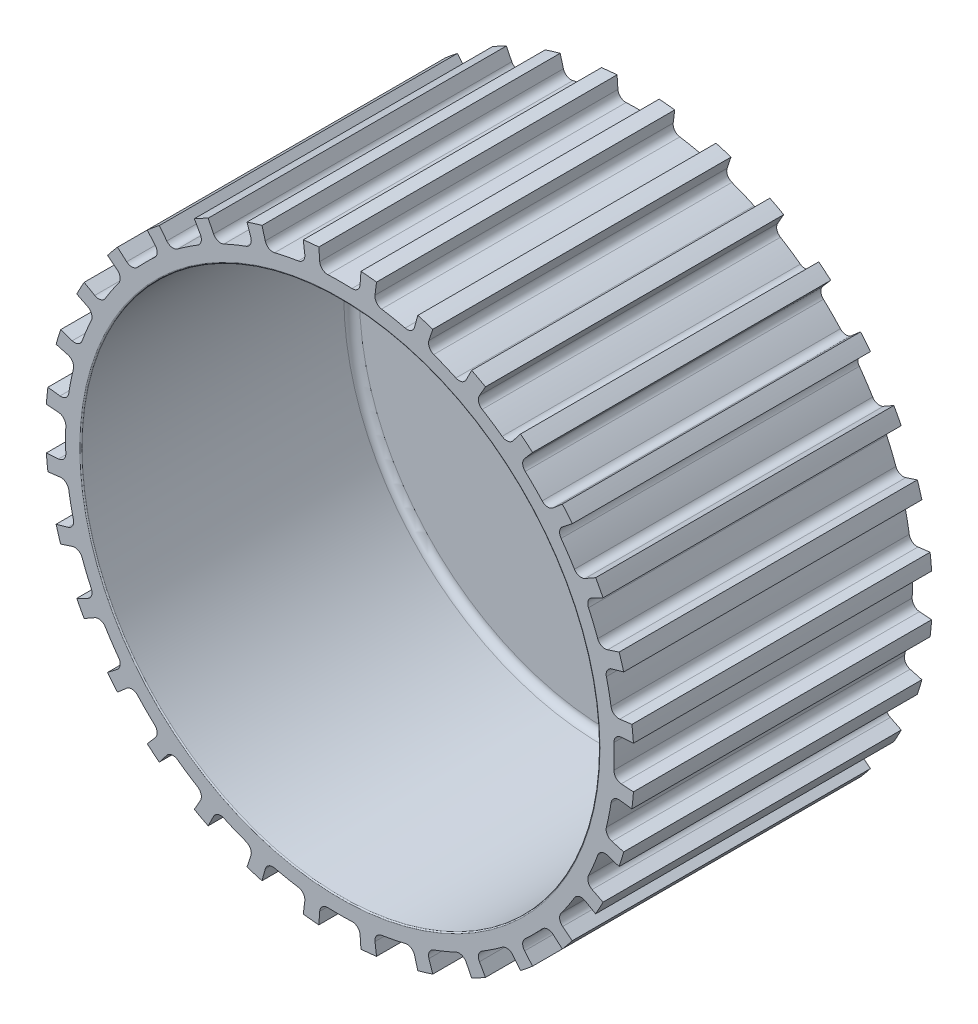
from build123d import *

# Parameters (mm, degrees)
SKETCH_1_R          = 75
EXTRUDE_1_DEPTH     = 7
SKETCH_2_R          = 75
SKETCH_2_R_2        = 66
EXTRUDE_2_DEPTH     = 69
SKETCH_4_R          = 14
EXTRUDE_3_DEPTH     = 7
SKETCH_5_R          = 5.05
SKETCH_5_R_2        = 1.2
CUT_EXTRUDE_2_DEPTH = 131.483715459
CUT_EXTRUDE_3_DEPTH = 131.483715459
FILLET_2_R          = 2
FILLET1_R           = 2
CHAMFER1_SIZE       = 0.3
FILLET2_R           = 0.3
FILLET_3_R          = 8
SKETCH_8_R          = 1.45
CUT_EXTRUDE_5_DEPTH = 123.623274056


with BuildPart() as part:
    # 草图1 → 凸台-拉伸1 (new body)
    with BuildSketch(Plane.XY):
        Circle(SKETCH_1_R)
    extrude(amount=EXTRUDE_1_DEPTH)

    # 草图2 → 凸台-拉伸2 (add)
    with BuildSketch(Plane.XY.offset(7)):
        Circle(SKETCH_2_R)
        Circle(SKETCH_2_R_2, mode=Mode.SUBTRACT)
    extrude(amount=EXTRUDE_2_DEPTH)

    # 草图4 → 凸台-拉伸3 (add)
    with BuildSketch(Plane.XY.offset(7)):
        Circle(SKETCH_4_R)
    extrude(amount=EXTRUDE_3_DEPTH)

    # 草图5 → 切除-拉伸2 (cut, through all)
    with BuildSketch(Plane(origin=(0, 0, 0), x_dir=(-1, 0, 0), z_dir=(0, 0, -1))):
        Circle(SKETCH_5_R)
        with Locations((0, 8)):
            Circle(SKETCH_5_R_2)
        with Locations((8, 0)):
            Circle(SKETCH_5_R_2)
        with Locations((0, -8)):
            Circle(SKETCH_5_R_2)
        with Locations((-8, 0)):
            Circle(SKETCH_5_R_2)
    extrude(amount=-CUT_EXTRUDE_2_DEPTH, mode=Mode.SUBTRACT)

    # 草图6 → 切除-拉伸3 (cut, through all)
    with BuildSketch(Plane.XY.offset(76)):
        with BuildLine():
            Line((5.694360027, 79.423791275), (5, 69.738996918))
            ThreePointArc((5, 69.738996918), (0, 69.918006916), (-5, 69.738996918))
            Line((-5, 69.738996918), (-5.694360027, 79.423791275))
            ThreePointArc((-5.694360027, 79.423791275), (0, 79.627660751), (5.694360027, 79.423791275))
        make_face()
        with BuildLine():
            Line((9.90986852, 79.008599928), (8.701476964, 69.374433257))
            ThreePointArc((8.701476964, 69.374433257), (13.640326484, 68.574552018), (18.509329767, 67.423530037))
            Line((18.509329767, 67.423530037), (21.079757511, 76.786770865))
            ThreePointArc((21.079757511, 76.786770865), (15.534585977, 78.097637577), (9.90986852, 79.008599928))
        make_face()
        with BuildLine():
            Line((25.133266377, 75.557152394), (22.068561048, 66.343849032))
            ThreePointArc((22.068561048, 66.343849032), (26.756462871, 64.595815544), (31.307356372, 62.517014709))
            Line((31.307356372, 62.517014709), (35.655071736, 71.198877913))
            ThreePointArc((35.655071736, 71.198877913), (30.472186527, 73.566365989), (25.133266377, 75.557152394))
        make_face()
        with BuildLine():
            Line((39.390806902, 69.202085866), (34.587562707, 60.763707895))
            ThreePointArc((34.587562707, 60.763707895), (38.844363395, 58.134698103), (42.902258829, 55.208005565))
            Line((42.902258829, 55.208005565), (48.86018155, 62.874852012))
            ThreePointArc((48.86018155, 62.874852012), (44.238758038, 66.207980213), (39.390806902, 69.202085866))
        make_face()
        with BuildLine():
            Line((52.134580809, 60.187621987), (45.777383728, 52.848451539))
            ThreePointArc((45.777383728, 52.848451539), (49.439496817, 49.439496817), (52.848451539, 45.777383728))
            Line((52.848451539, 45.777383728), (60.187621987, 52.134580809))
            ThreePointArc((60.187621987, 52.134580809), (56.305258887, 56.305258887), (52.134580809, 60.187621987))
        make_face()
        with BuildLine():
            Line((62.874852012, 48.86018155), (55.208005565, 42.902258829))
            ThreePointArc((55.208005565, 42.902258829), (58.134698103, 38.844363395), (60.763707895, 34.587562707))
            Line((60.763707895, 34.587562707), (69.202085866, 39.390806902))
            ThreePointArc((69.202085866, 39.390806902), (66.207980213, 44.238758038), (62.874852012, 48.86018155))
        make_face()
        with BuildLine():
            Line((71.198877913, 35.655071736), (62.517014709, 31.307356372))
            ThreePointArc((62.517014709, 31.307356372), (64.595815544, 26.756462871), (66.343849032, 22.068561048))
            Line((66.343849032, 22.068561048), (75.557152394, 25.133266377))
            ThreePointArc((75.557152394, 25.133266377), (73.566365989, 30.472186527), (71.198877913, 35.655071736))
        make_face()
        with BuildLine():
            Line((76.786770865, 21.079757511), (67.423530037, 18.509329767))
            ThreePointArc((67.423530037, 18.509329767), (68.574552018, 13.640326484), (69.374433257, 8.701476964))
            Line((69.374433257, 8.701476964), (79.008599928, 9.90986852))
            ThreePointArc((79.008599928, 9.90986852), (78.097637577, 15.534585977), (76.786770865, 21.079757511))
        make_face()
        with BuildLine():
            Line((79.423791275, 5.694360027), (69.738996918, 5))
            ThreePointArc((69.738996918, 5), (69.918006916, 0), (69.738996918, -5))
            Line((69.738996918, -5), (79.423791275, -5.694360027))
            ThreePointArc((79.423791275, -5.694360027), (79.627660751, 0), (79.423791275, 5.694360027))
        make_face()
        with BuildLine():
            Line((79.008599928, -9.90986852), (69.374433257, -8.701476964))
            ThreePointArc((69.374433257, -8.701476964), (68.574552018, -13.640326484), (67.423530037, -18.509329767))
            Line((67.423530037, -18.509329767), (76.786770865, -21.079757511))
            ThreePointArc((76.786770865, -21.079757511), (78.097637577, -15.534585977), (79.008599928, -9.90986852))
        make_face()
        with BuildLine():
            Line((75.557152394, -25.133266377), (66.343849032, -22.068561048))
            ThreePointArc((66.343849032, -22.068561048), (64.595815544, -26.756462871), (62.517014709, -31.307356372))
            Line((62.517014709, -31.307356372), (71.198877913, -35.655071736))
            ThreePointArc((71.198877913, -35.655071736), (73.566365989, -30.472186527), (75.557152394, -25.133266377))
        make_face()
        with BuildLine():
            Line((69.202085866, -39.390806902), (60.763707895, -34.587562707))
            ThreePointArc((60.763707895, -34.587562707), (58.134698103, -38.844363395), (55.208005565, -42.902258829))
            Line((55.208005565, -42.902258829), (62.874852012, -48.86018155))
            ThreePointArc((62.874852012, -48.86018155), (66.207980213, -44.238758038), (69.202085866, -39.390806902))
        make_face()
        with BuildLine():
            Line((60.187621987, -52.134580809), (52.848451539, -45.777383728))
            ThreePointArc((52.848451539, -45.777383728), (49.439496817, -49.439496817), (45.777383728, -52.848451539))
            Line((45.777383728, -52.848451539), (52.134580809, -60.187621987))
            ThreePointArc((52.134580809, -60.187621987), (56.305258887, -56.305258887), (60.187621987, -52.134580809))
        make_face()
        with BuildLine():
            Line((48.86018155, -62.874852012), (42.902258829, -55.208005565))
            ThreePointArc((42.902258829, -55.208005565), (38.844363395, -58.134698103), (34.587562707, -60.763707895))
            Line((34.587562707, -60.763707895), (39.390806902, -69.202085866))
            ThreePointArc((39.390806902, -69.202085866), (44.238758038, -66.207980213), (48.86018155, -62.874852012))
        make_face()
        with BuildLine():
            Line((35.655071736, -71.198877913), (31.307356372, -62.517014709))
            ThreePointArc((31.307356372, -62.517014709), (26.756462871, -64.595815544), (22.068561048, -66.343849032))
            Line((22.068561048, -66.343849032), (25.133266377, -75.557152394))
            ThreePointArc((25.133266377, -75.557152394), (30.472186527, -73.566365989), (35.655071736, -71.198877913))
        make_face()
        with BuildLine():
            Line((21.079757511, -76.786770865), (18.509329767, -67.423530037))
            ThreePointArc((18.509329767, -67.423530037), (13.640326484, -68.574552018), (8.701476964, -69.374433257))
            Line((8.701476964, -69.374433257), (9.90986852, -79.008599928))
            ThreePointArc((9.90986852, -79.008599928), (15.534585977, -78.097637577), (21.079757511, -76.786770865))
        make_face()
        with BuildLine():
            Line((5.694360027, -79.423791275), (5, -69.738996918))
            ThreePointArc((5, -69.738996918), (0, -69.918006916), (-5, -69.738996918))
            Line((-5, -69.738996918), (-5.694360027, -79.423791275))
            ThreePointArc((-5.694360027, -79.423791275), (0, -79.627660751), (5.694360027, -79.423791275))
        make_face()
        with BuildLine():
            Line((-9.90986852, -79.008599928), (-8.701476964, -69.374433257))
            ThreePointArc((-8.701476964, -69.374433257), (-13.640326484, -68.574552018), (-18.509329767, -67.423530037))
            Line((-18.509329767, -67.423530037), (-21.079757511, -76.786770865))
            ThreePointArc((-21.079757511, -76.786770865), (-15.534585977, -78.097637577), (-9.90986852, -79.008599928))
        make_face()
        with BuildLine():
            Line((-25.133266377, -75.557152394), (-22.068561048, -66.343849032))
            ThreePointArc((-22.068561048, -66.343849032), (-26.756462871, -64.595815544), (-31.307356372, -62.517014709))
            Line((-31.307356372, -62.517014709), (-35.655071736, -71.198877913))
            ThreePointArc((-35.655071736, -71.198877913), (-30.472186527, -73.566365989), (-25.133266377, -75.557152394))
        make_face()
        with BuildLine():
            Line((-39.390806902, -69.202085866), (-34.587562707, -60.763707895))
            ThreePointArc((-34.587562707, -60.763707895), (-38.844363395, -58.134698103), (-42.902258829, -55.208005565))
            Line((-42.902258829, -55.208005565), (-48.86018155, -62.874852012))
            ThreePointArc((-48.86018155, -62.874852012), (-44.238758038, -66.207980213), (-39.390806902, -69.202085866))
        make_face()
        with BuildLine():
            Line((-52.134580809, -60.187621987), (-45.777383728, -52.848451539))
            ThreePointArc((-45.777383728, -52.848451539), (-49.439496817, -49.439496817), (-52.848451539, -45.777383728))
            Line((-52.848451539, -45.777383728), (-60.187621987, -52.134580809))
            ThreePointArc((-60.187621987, -52.134580809), (-56.305258887, -56.305258887), (-52.134580809, -60.187621987))
        make_face()
        with BuildLine():
            Line((-62.874852012, -48.86018155), (-55.208005565, -42.902258829))
            ThreePointArc((-55.208005565, -42.902258829), (-58.134698103, -38.844363395), (-60.763707895, -34.587562707))
            Line((-60.763707895, -34.587562707), (-69.202085866, -39.390806902))
            ThreePointArc((-69.202085866, -39.390806902), (-66.207980213, -44.238758038), (-62.874852012, -48.86018155))
        make_face()
        with BuildLine():
            Line((-71.198877913, -35.655071736), (-62.517014709, -31.307356372))
            ThreePointArc((-62.517014709, -31.307356372), (-64.595815544, -26.756462871), (-66.343849032, -22.068561048))
            Line((-66.343849032, -22.068561048), (-75.557152394, -25.133266377))
            ThreePointArc((-75.557152394, -25.133266377), (-73.566365989, -30.472186527), (-71.198877913, -35.655071736))
        make_face()
        with BuildLine():
            Line((-76.786770865, -21.079757511), (-67.423530037, -18.509329767))
            ThreePointArc((-67.423530037, -18.509329767), (-68.574552018, -13.640326484), (-69.374433257, -8.701476964))
            Line((-69.374433257, -8.701476964), (-79.008599928, -9.90986852))
            ThreePointArc((-79.008599928, -9.90986852), (-78.097637577, -15.534585977), (-76.786770865, -21.079757511))
        make_face()
        with BuildLine():
            Line((-79.423791275, -5.694360027), (-69.738996918, -5))
            ThreePointArc((-69.738996918, -5), (-69.918006916, 0), (-69.738996918, 5))
            Line((-69.738996918, 5), (-79.423791275, 5.694360027))
            ThreePointArc((-79.423791275, 5.694360027), (-79.627660751, 0), (-79.423791275, -5.694360027))
        make_face()
        with BuildLine():
            Line((-79.008599928, 9.90986852), (-69.374433257, 8.701476964))
            ThreePointArc((-69.374433257, 8.701476964), (-68.574552018, 13.640326484), (-67.423530037, 18.509329767))
            Line((-67.423530037, 18.509329767), (-76.786770865, 21.079757511))
            ThreePointArc((-76.786770865, 21.079757511), (-78.097637577, 15.534585977), (-79.008599928, 9.90986852))
        make_face()
        with BuildLine():
            Line((-75.557152394, 25.133266377), (-66.343849032, 22.068561048))
            ThreePointArc((-66.343849032, 22.068561048), (-64.595815544, 26.756462871), (-62.517014709, 31.307356372))
            Line((-62.517014709, 31.307356372), (-71.198877913, 35.655071736))
            ThreePointArc((-71.198877913, 35.655071736), (-73.566365989, 30.472186527), (-75.557152394, 25.133266377))
        make_face()
        with BuildLine():
            Line((-69.202085866, 39.390806902), (-60.763707895, 34.587562707))
            ThreePointArc((-60.763707895, 34.587562707), (-58.134698103, 38.844363395), (-55.208005565, 42.902258829))
            Line((-55.208005565, 42.902258829), (-62.874852012, 48.86018155))
            ThreePointArc((-62.874852012, 48.86018155), (-66.207980213, 44.238758038), (-69.202085866, 39.390806902))
        make_face()
        with BuildLine():
            Line((-60.187621987, 52.134580809), (-52.848451539, 45.777383728))
            ThreePointArc((-52.848451539, 45.777383728), (-49.439496817, 49.439496817), (-45.777383728, 52.848451539))
            Line((-45.777383728, 52.848451539), (-52.134580809, 60.187621987))
            ThreePointArc((-52.134580809, 60.187621987), (-56.305258887, 56.305258887), (-60.187621987, 52.134580809))
        make_face()
        with BuildLine():
            Line((-48.86018155, 62.874852012), (-42.902258829, 55.208005565))
            ThreePointArc((-42.902258829, 55.208005565), (-38.844363395, 58.134698103), (-34.587562707, 60.763707895))
            Line((-34.587562707, 60.763707895), (-39.390806902, 69.202085866))
            ThreePointArc((-39.390806902, 69.202085866), (-44.238758038, 66.207980213), (-48.86018155, 62.874852012))
        make_face()
        with BuildLine():
            Line((-35.655071736, 71.198877913), (-31.307356372, 62.517014709))
            ThreePointArc((-31.307356372, 62.517014709), (-26.756462871, 64.595815544), (-22.068561048, 66.343849032))
            Line((-22.068561048, 66.343849032), (-25.133266377, 75.557152394))
            ThreePointArc((-25.133266377, 75.557152394), (-30.472186527, 73.566365989), (-35.655071736, 71.198877913))
        make_face()
        with BuildLine():
            Line((-21.079757511, 76.786770865), (-18.509329767, 67.423530037))
            ThreePointArc((-18.509329767, 67.423530037), (-13.640326484, 68.574552018), (-8.701476964, 69.374433257))
            Line((-8.701476964, 69.374433257), (-9.90986852, 79.008599928))
            ThreePointArc((-9.90986852, 79.008599928), (-15.534585977, 78.097637577), (-21.079757511, 76.786770865))
        make_face()
    extrude(amount=-CUT_EXTRUDE_3_DEPTH, mode=Mode.SUBTRACT)

    # 圆角2
    fillet_2_edges = [part.edges().sort_by_distance(p)[0] for p in [
        (-60.763707895, 34.587562707, 38),
        (-55.208005565, 42.902258829, 38),
        (-52.848451539, 45.777383728, 38),
        (-45.777383728, 52.848451539, 38),
        (-66.343849032, 22.068561048, 38),
        (-62.517014709, 31.307356372, 38),
        (-69.374433257, 8.701476964, 38),
        (-67.423530037, 18.509329767, 38),
        (-31.307356372, 62.517014709, 38),
        (-22.068561048, 66.343849032, 38),
        (-42.902258829, 55.208005565, 38),
        (-34.587562707, 60.763707895, 38),
        (-18.509329767, 67.423530037, 38),
        (-8.701476964, 69.374433257, 38),
        (-34.587562707, -60.763707895, 38),
        (-42.902258829, -55.208005565, 38),
        (-45.777383728, -52.848451539, 38),
        (-52.848451539, -45.777383728, 38),
        (-22.068561048, -66.343849032, 38),
        (-31.307356372, -62.517014709, 38),
        (-8.701476964, -69.374433257, 38),
        (-18.509329767, -67.423530037, 38),
        (-62.517014709, -31.307356372, 38),
        (-66.343849032, -22.068561048, 38),
        (-55.208005565, -42.902258829, 38),
        (-60.763707895, -34.587562707, 38),
        (-67.423530037, -18.509329767, 38),
        (-69.374433257, -8.701476964, 38),
        (-69.738996918, -5, 38),
        (-69.738996918, 5, 38),
        (60.763707895, -34.587562707, 38),
        (55.208005565, -42.902258829, 38),
        (52.848451539, -45.777383728, 38),
        (45.777383728, -52.848451539, 38),
        (66.343849032, -22.068561048, 38),
        (62.517014709, -31.307356372, 38),
        (69.374433257, -8.701476964, 38),
        (67.423530037, -18.509329767, 38),
        (31.307356372, -62.517014709, 38),
        (22.068561048, -66.343849032, 38),
        (42.902258829, -55.208005565, 38),
        (34.587562707, -60.763707895, 38),
        (18.509329767, -67.423530037, 38),
        (8.701476964, -69.374433257, 38),
        (5, -69.738996918, 38),
        (-5, -69.738996918, 38),
        (34.587562707, 60.763707895, 38),
        (42.902258829, 55.208005565, 38),
        (45.777383728, 52.848451539, 38),
        (52.848451539, 45.777383728, 38),
        (22.068561048, 66.343849032, 38),
        (31.307356372, 62.517014709, 38),
        (8.701476964, 69.374433257, 38),
        (18.509329767, 67.423530037, 38),
        (62.517014709, 31.307356372, 38),
        (66.343849032, 22.068561048, 38),
        (55.208005565, 42.902258829, 38),
        (60.763707895, 34.587562707, 38),
        (67.423530037, 18.509329767, 38),
        (69.374433257, 8.701476964, 38),
        (69.738996918, 5, 38),
        (69.738996918, -5, 38),
        (-5, 69.738996918, 38),
        (5, 69.738996918, 38),
    ]]
    fillet(fillet_2_edges, radius=FILLET_2_R)

    # Fillet1
    fillet1_edges = [part.edges().sort_by_distance(p)[0] for p in [
        (-66, 0, 7),
    ]]
    fillet(fillet1_edges, radius=FILLET1_R)

    # Chamfer1
    chamfer1_edges = [part.edges().sort_by_distance(p)[0] for p in [
        (5.05, 0, 14),
    ]]
    chamfer(chamfer1_edges, length=CHAMFER1_SIZE)

    # Fillet2
    fillet2_edges = [part.edges().sort_by_distance(p)[0] for p in [
        (-66, 0, 76),
    ]]
    fillet(fillet2_edges, radius=FILLET2_R)

    # 圆角3
    # the kernel refuses this fillet: 8 mm, written as the material it adds along each edge
    with BuildSketch(Plane(origin=(0, 0, 7), x_dir=(1, 0, 0), z_dir=(0, -1, 0))) as fillet_3_piece_1:
        with BuildLine():
            CenterArc((21.937253933, 8), FILLET_3_R, 187.180755781, 82.819244219)
            Line((14, 7), (13.841254921, 6.98))
            ThreePointArc((13.841254921, 6.98), (13.84, 3.5), (13.84, 0))
            Line((13.84, 0), (14, -0.16))
            Line((14, -0.16), (21.937253933, -0.16))
            Line((21.937253933, -0.16), (21.937253933, 0))
        make_face()
    revolve(axis=Axis((0, 0, 7), (0, 0, 1)))

    # 草图8 → 切除-拉伸5 (cut, through all)
    with BuildSketch(Plane.XY.offset(14)):
        with Locations((-7.778174593, 7.778174593)):
            Circle(SKETCH_8_R)
        with Locations((7.778174593, 7.778174593)):
            Circle(SKETCH_8_R)
        with Locations((7.778174593, -7.778174593)):
            Circle(SKETCH_8_R)
        with Locations((-7.778174593, -7.778174593)):
            Circle(SKETCH_8_R)
    extrude(amount=-CUT_EXTRUDE_5_DEPTH, mode=Mode.SUBTRACT)


solid = part.part
